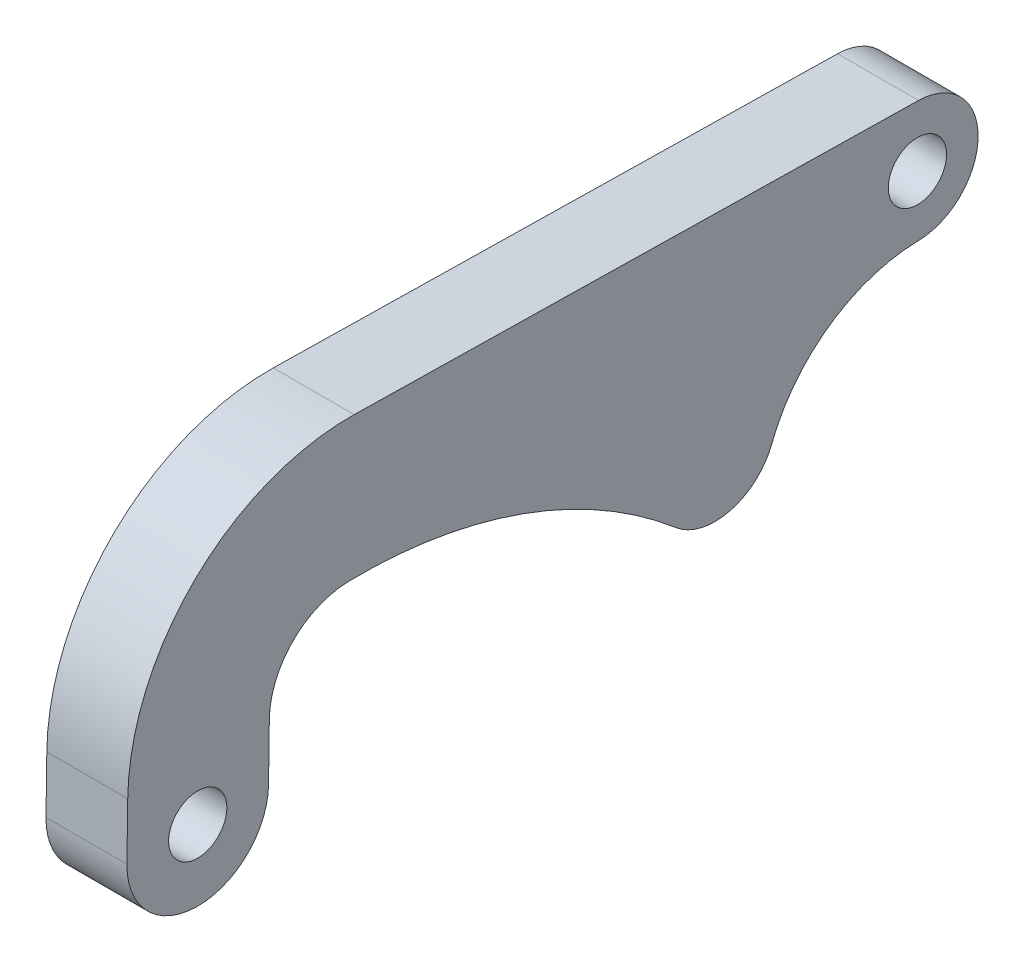
from build123d import *

# Parameters (mm, degrees)
SKETCH1_R           = 2.286
BOSS_EXTRUDE1_DEPTH = 3.175


with BuildPart() as part:
    # Sketch1 → Boss-Extrude1 (new, symmetric)
    with BuildSketch(Plane(origin=(0, 0, 0), x_dir=(0, 0, -1), z_dir=(1, 0, 0))):
        with BuildLine():
            Line((-5.555690027, 0.078882129), (-5.492947583, 4.497849692))
            ThreePointArc((-5.492947583, 4.497849692), (-0.180708129, 16.793970412), (12.279247772, 21.709656704))
            Line((12.279247772, 21.709656704), (56.556266052, 20.919821075))
            ThreePointArc((56.556266052, 20.919821075), (61.233823705, 16.158078636), (56.556266052, 11.396336198))
            ThreePointArc((56.556266052, 11.396336198), (49.56780942, 9.124706187), (45.041369891, 3.335908885))
            ThreePointArc((45.041369891, 3.335908885), (41.771149469, 0.430257339), (37.509684519, 1.418725347))
            ThreePointArc((37.509684519, 1.418725347), (25.520855431, 8.352797068), (11.854536038, 10.598924348))
            ThreePointArc((11.854536038, 10.598924348), (7.469501812, 8.731884997), (5.61843247, 4.340085435))
            Line((5.61843247, 4.340085435), (5.555690027, -0.078882129))
            ThreePointArc((5.555690027, -0.078882129), (-0.078882129, -5.555690027), (-5.555690027, 0.078882129))
        make_face()
        Circle(SKETCH1_R, mode=Mode.SUBTRACT)
        with Locations((56.471323705, 16.158078636)):
            Circle(SKETCH1_R, mode=Mode.SUBTRACT)
    extrude(amount=BOSS_EXTRUDE1_DEPTH, both=True)


solid = part.part
